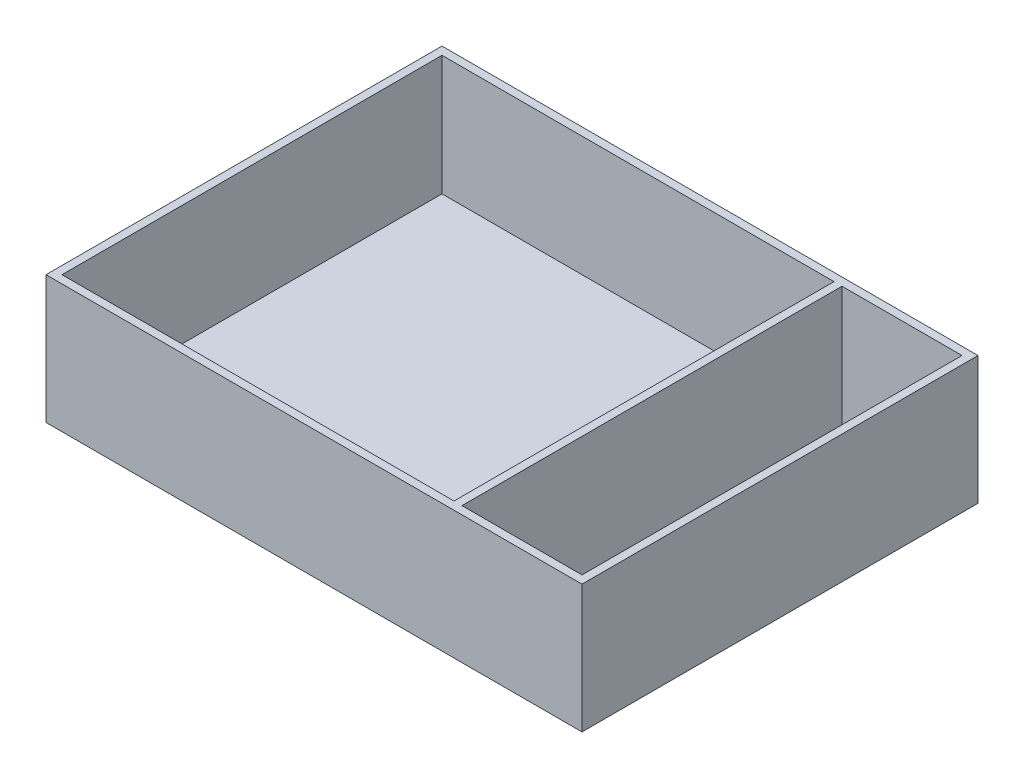
from build123d import *

# Parameters (mm, degrees)
CROQUIS1_W              = 268
CROQUIS1_H              = 198
CROQUIS1_W_2            = 260
CROQUIS1_H_2            = 190
SALIENTE_EXTRUIR1_DEPTH = 60
CROQUIS3_W              = 268
CROQUIS3_H              = 198
SALIENTE_EXTRUIR2_DEPTH = 4
CROQUIS4_W              = 4
CROQUIS4_H              = 190
SALIENTE_EXTRUIR3_DEPTH = 60


with BuildPart() as part:
    # Croquis1 → Saliente-Extruir1 (new body)
    with BuildSketch(Plane(origin=(0, 0, 0), x_dir=(1, 0, 0), z_dir=(0, 1, 0))):
        Rectangle(CROQUIS1_W, CROQUIS1_H)
        Rectangle(CROQUIS1_W_2, CROQUIS1_H_2, mode=Mode.SUBTRACT)
    extrude(amount=SALIENTE_EXTRUIR1_DEPTH)

    # Croquis3 → Saliente-Extruir2 (add)
    with BuildSketch(Plane.XZ):
        Rectangle(CROQUIS3_W, CROQUIS3_H)
    extrude(amount=SALIENTE_EXTRUIR2_DEPTH)

    # Croquis4 → Saliente-Extruir3 (add)
    with BuildSketch(Plane(origin=(0, 0, 0), x_dir=(1, 0, 0), z_dir=(0, 1, 0))):
        with Locations((68, 0)):
            Rectangle(CROQUIS4_W, CROQUIS4_H)
    extrude(amount=SALIENTE_EXTRUIR3_DEPTH)


solid = part.part
